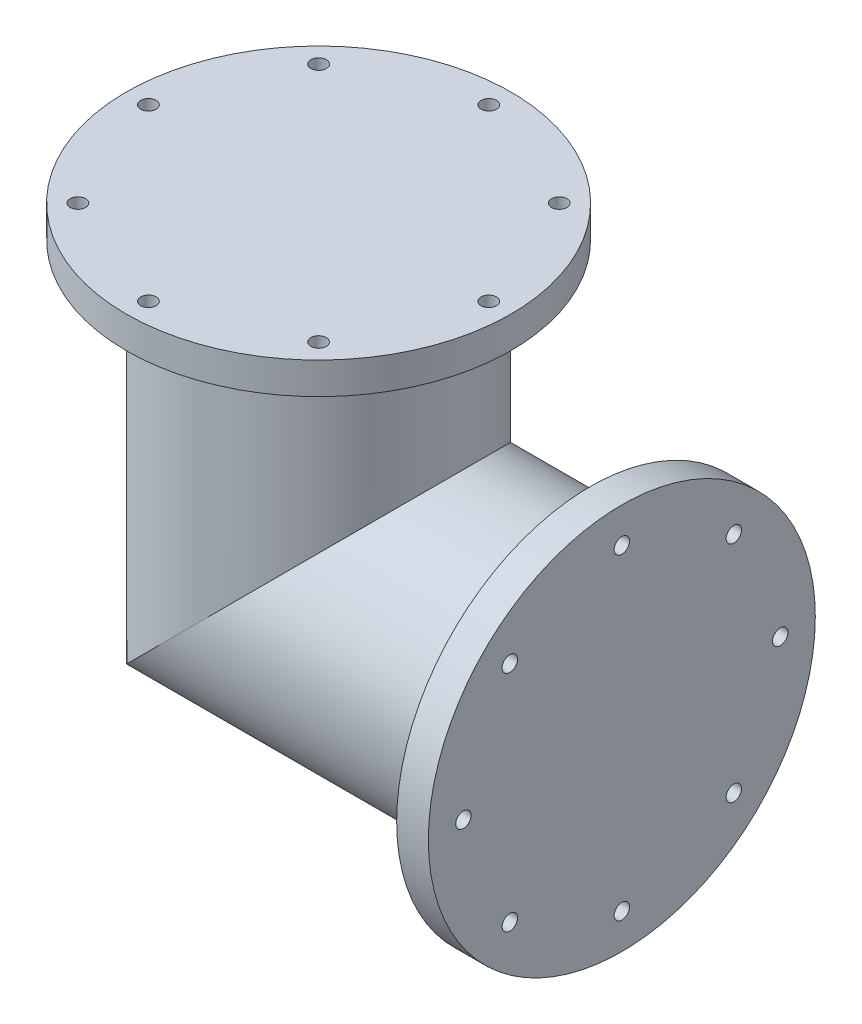
from build123d import *

# Parameters (mm, degrees)
CROQUIS1_R                                     = 42.75
SALIENTE_EXTRUIR1_DEPTH                        = 3.5
SALIENTE_EXTRUIR2_REACH                        = 181
CROQUIS3_R                                     = 30
CROQUIS3_R_2                                   = 25
SALIENTE_EXTRUIR3_REACH                        = 210.151
CROQUIS4_R                                     = 30
CROQUIS4_R_2                                   = 25
REFRENTADO_PARA_TORNILLO_CON_CABEZA_2_COUNT    = 2
REFRENTADO_PARA_TORNILLO_CON_CABEZA_2_PITCH    = 26.787840266
REFRENTADO_PARA_TORNILLO_CON_CABEZA_3_COUNT    = 2
REFRENTADO_PARA_TORNILLO_CON_CABEZA_3_PITCH    = 49.497474683
REFRENTADO_PARA_TORNILLO_CON_CABEZA_4_COUNT    = 2
REFRENTADO_PARA_TORNILLO_CON_CABEZA_4_PITCH    = 64.671567276
REFRENTADO_PARA_TORNILLO_CON_CABEZA_5_COUNT    = 2
REFRENTADO_PARA_TORNILLO_CON_CABEZA_5_PITCH    = 70
REFRENTADO_PARA_TORNILLO_CON_CABEZA_6_COUNT    = 2
REFRENTADO_PARA_TORNILLO_CON_CABEZA_6_PITCH    = 64.671567276
REFRENTADO_PARA_TORNILLO_CON_CABEZA_7_COUNT    = 2
REFRENTADO_PARA_TORNILLO_CON_CABEZA_7_PITCH    = 49.497474683
REFRENTADO_PARA_TORNILLO_CON_CABEZA_8_COUNT    = 2
REFRENTADO_PARA_TORNILLO_CON_CABEZA_8_PITCH    = 26.787840266
CROQUIS8_R                                     = 42.5
SALIENTE_EXTRUIR4_DEPTH                        = 7
REFRENTADO_PARA_TORNILLO_CON_CABEZA_9_AT_COUNT = 2
REFRENTADO_PARA_TORNILLO_CON_CABEZA_9_AT_PITCH = 28.777794114
REFRENTADO_PARA_TORNILLO_CON_CABEZA_10_COUNT   = 2
REFRENTADO_PARA_TORNILLO_CON_CABEZA_10_PITCH   = 53.174429945
REFRENTADO_PARA_TORNILLO_CON_CABEZA_11_COUNT   = 2
REFRENTADO_PARA_TORNILLO_CON_CABEZA_11_PITCH   = 69.475740845
REFRENTADO_PARA_TORNILLO_CON_CABEZA_12_COUNT   = 2
REFRENTADO_PARA_TORNILLO_CON_CABEZA_12_PITCH   = 75.2
REFRENTADO_PARA_TORNILLO_CON_CABEZA_13_COUNT   = 2
REFRENTADO_PARA_TORNILLO_CON_CABEZA_13_PITCH   = 69.475740845
REFRENTADO_PARA_TORNILLO_CON_CABEZA_14_COUNT   = 2
REFRENTADO_PARA_TORNILLO_CON_CABEZA_14_PITCH   = 53.174429945
REFRENTADO_PARA_TORNILLO_CON_CABEZA_15_COUNT   = 2
REFRENTADO_PARA_TORNILLO_CON_CABEZA_15_PITCH   = 28.777794114


with BuildPart() as part:
    # Croquis1 → Saliente-Extruir1 (new, symmetric)
    with BuildSketch(Plane(origin=(0, 0, 0), x_dir=(0, 0, -1), z_dir=(1, 0, 0))):
        Circle(CROQUIS1_R)
    extrude(amount=SALIENTE_EXTRUIR1_DEPTH, both=True)

    # Saliente-Extruir2: up to this plane
    saliente_extruir2_end = Plane(origin=(-63.5, 0, 0), z_dir=(-0.7071067811865489, 0.7071067811865461, 0))
    # Croquis3 → Saliente-Extruir2 (add, up to the surface)
    with BuildSketch(Plane.ZY.offset(3.5), mode=Mode.PRIVATE) as saliente_extruir2_sk1:
        Circle(CROQUIS3_R)
        Circle(CROQUIS3_R_2, mode=Mode.SUBTRACT)
    saliente_extruir2_tool1 = split(extrude(saliente_extruir2_sk1.sketch, amount=SALIENTE_EXTRUIR2_REACH, mode=Mode.PRIVATE), bisect_by=saliente_extruir2_end, keep=Keep.BOTH, mode=Mode.PRIVATE)
    add(saliente_extruir2_tool1.solids().sort_by_distance((-3.5, 0, -29.151472))[0])

    # Croquis7 → Refrentado para tornillo con cabeza tron (revolve, cut)
    with BuildSketch(Plane(origin=(-3.5, 35, 0), x_dir=(0, 0, 1), z_dir=(0, 1, 0))):
        Polygon((0, 0), (0, 7), (1.7, 7), (1.7, 2.4), (3.5, 2.4), (3.5, 0), align=None)
    refrentado_para_tornillo_con_cabeza_tron = revolve(axis=Axis((-9.85, 35, 0), (1, 0, 0)), mode=Mode.SUBTRACT)

    # Refrentado para tornillo con cabeza  2: Refrentado para tornillo con cabeza tron ×2
    with Locations(*[Vector(0, -0.3826834323650482, 0.9238795325113041) * (i * REFRENTADO_PARA_TORNILLO_CON_CABEZA_2_PITCH) for i in range(1, REFRENTADO_PARA_TORNILLO_CON_CABEZA_2_COUNT)]):
        add(refrentado_para_tornillo_con_cabeza_tron, mode=Mode.SUBTRACT)

    # Refrentado para tornillo con cabeza  3: Refrentado para tornillo con cabeza tron ×2
    with Locations(*[Vector(0, -0.7071067811865158, 0.7071067811865792) * (i * REFRENTADO_PARA_TORNILLO_CON_CABEZA_3_PITCH) for i in range(1, REFRENTADO_PARA_TORNILLO_CON_CABEZA_3_COUNT)]):
        add(refrentado_para_tornillo_con_cabeza_tron, mode=Mode.SUBTRACT)

    # Refrentado para tornillo con cabeza  4: Refrentado para tornillo con cabeza tron ×2
    with Locations(*[Vector(0, -0.9238795325112696, 0.3826834323651312) * (i * REFRENTADO_PARA_TORNILLO_CON_CABEZA_4_PITCH) for i in range(1, REFRENTADO_PARA_TORNILLO_CON_CABEZA_4_COUNT)]):
        add(refrentado_para_tornillo_con_cabeza_tron, mode=Mode.SUBTRACT)

    # Refrentado para tornillo con cabeza  5: Refrentado para tornillo con cabeza tron ×2
    with Locations(*[(0, -i * REFRENTADO_PARA_TORNILLO_CON_CABEZA_5_PITCH, 0) for i in range(1, REFRENTADO_PARA_TORNILLO_CON_CABEZA_5_COUNT)]):
        add(refrentado_para_tornillo_con_cabeza_tron, mode=Mode.SUBTRACT)

    # Refrentado para tornillo con cabeza  6: Refrentado para tornillo con cabeza tron ×2
    with Locations(*[Vector(0, -0.923879532511304, -0.38268343236504837) * (i * REFRENTADO_PARA_TORNILLO_CON_CABEZA_6_PITCH) for i in range(1, REFRENTADO_PARA_TORNILLO_CON_CABEZA_6_COUNT)]):
        add(refrentado_para_tornillo_con_cabeza_tron, mode=Mode.SUBTRACT)

    # Refrentado para tornillo con cabeza  7: Refrentado para tornillo con cabeza tron ×2
    with Locations(*[Vector(0, -0.7071067811865792, -0.7071067811865158) * (i * REFRENTADO_PARA_TORNILLO_CON_CABEZA_7_PITCH) for i in range(1, REFRENTADO_PARA_TORNILLO_CON_CABEZA_7_COUNT)]):
        add(refrentado_para_tornillo_con_cabeza_tron, mode=Mode.SUBTRACT)

    # Refrentado para tornillo con cabeza  8: Refrentado para tornillo con cabeza tron ×2
    with Locations(*[Vector(0, -0.3826834323651309, -0.9238795325112698) * (i * REFRENTADO_PARA_TORNILLO_CON_CABEZA_8_PITCH) for i in range(1, REFRENTADO_PARA_TORNILLO_CON_CABEZA_8_COUNT)]):
        add(refrentado_para_tornillo_con_cabeza_tron, mode=Mode.SUBTRACT)


with BuildPart() as body_2:
    # Saliente-Extruir3: up to this plane
    saliente_extruir3_end = Plane(origin=(-63.5, 0, 0), z_dir=(-0.7071067811865489, 0.7071067811865461, 0))
    # Croquis4 → Saliente-Extruir3 (new, up to the surface)
    with BuildSketch(Plane(origin=(0, 60, 0), x_dir=(1, 0, 0), z_dir=(0, 1, 0)), mode=Mode.PRIVATE) as saliente_extruir3_sk1:
        with Locations((-63.5, 0)):
            Circle(CROQUIS4_R)
        with Locations((-63.5, 0)):
            Circle(CROQUIS4_R_2, mode=Mode.SUBTRACT)
    saliente_extruir3_tool1 = split(extrude(saliente_extruir3_sk1.sketch, amount=-SALIENTE_EXTRUIR3_REACH, mode=Mode.PRIVATE), bisect_by=saliente_extruir3_end, keep=Keep.BOTH, mode=Mode.PRIVATE)
    add(saliente_extruir3_tool1.solids().sort_by_distance((-92.651472, 60, 0))[0])

    # Croquis8 → Saliente-Extruir4 (add)
    with BuildSketch(Plane(origin=(0, 60, 0), x_dir=(1, 0, 0), z_dir=(0, 1, 0))):
        with Locations((-63.5, 0)):
            Circle(CROQUIS8_R)
    extrude(amount=SALIENTE_EXTRUIR4_DEPTH)

    # Croquis10 → Refrentado para tornillo con cabeza  9 (revolve, cut)
    with BuildSketch(Plane(origin=(-63.5, 60, 37.6), x_dir=(0, 0, -1), z_dir=(1, 0, 0))):
        Polygon((0, 0), (0, 7.001), (1.7, 7.001), (1.7, 2.4), (3.5, 2.4), (3.5, 0), align=None)
    refrentado_para_tornillo_con_cabeza_9 = revolve(axis=Axis((-63.5, 53.65, 37.6), (0, 1, 0)), mode=Mode.SUBTRACT)

    # Refrentado para tornillo con cabeza 9 at: Refrentado para tornillo con cabeza  9 ×2
    with Locations(*[Vector(0.923879532511287, 0, -0.38268343236508934) * (i * REFRENTADO_PARA_TORNILLO_CON_CABEZA_9_AT_PITCH) for i in range(1, REFRENTADO_PARA_TORNILLO_CON_CABEZA_9_AT_COUNT)]):
        add(refrentado_para_tornillo_con_cabeza_9, mode=Mode.SUBTRACT)

    # Refrentado para tornillo con cabeza  10: Refrentado para tornillo con cabeza  9 ×2
    with Locations(*[Vector(0.7071067811865479, 0, -0.7071067811865471) * (i * REFRENTADO_PARA_TORNILLO_CON_CABEZA_10_PITCH) for i in range(1, REFRENTADO_PARA_TORNILLO_CON_CABEZA_10_COUNT)]):
        add(refrentado_para_tornillo_con_cabeza_9, mode=Mode.SUBTRACT)

    # Refrentado para tornillo con cabeza  11: Refrentado para tornillo con cabeza  9 ×2
    with Locations(*[Vector(0.3826834323650902, 0, -0.9238795325112866) * (i * REFRENTADO_PARA_TORNILLO_CON_CABEZA_11_PITCH) for i in range(1, REFRENTADO_PARA_TORNILLO_CON_CABEZA_11_COUNT)]):
        add(refrentado_para_tornillo_con_cabeza_9, mode=Mode.SUBTRACT)

    # Refrentado para tornillo con cabeza  12: Refrentado para tornillo con cabeza  9 ×2
    with Locations(*[(0, 0, -i * REFRENTADO_PARA_TORNILLO_CON_CABEZA_12_PITCH) for i in range(1, REFRENTADO_PARA_TORNILLO_CON_CABEZA_12_COUNT)]):
        add(refrentado_para_tornillo_con_cabeza_9, mode=Mode.SUBTRACT)

    # Refrentado para tornillo con cabeza  13: Refrentado para tornillo con cabeza  9 ×2
    with Locations(*[Vector(-0.38268343236508945, 0, -0.923879532511287) * (i * REFRENTADO_PARA_TORNILLO_CON_CABEZA_13_PITCH) for i in range(1, REFRENTADO_PARA_TORNILLO_CON_CABEZA_13_COUNT)]):
        add(refrentado_para_tornillo_con_cabeza_9, mode=Mode.SUBTRACT)

    # Refrentado para tornillo con cabeza  14: Refrentado para tornillo con cabeza  9 ×2
    with Locations(*[Vector(-0.7071067811865472, 0, -0.7071067811865478) * (i * REFRENTADO_PARA_TORNILLO_CON_CABEZA_14_PITCH) for i in range(1, REFRENTADO_PARA_TORNILLO_CON_CABEZA_14_COUNT)]):
        add(refrentado_para_tornillo_con_cabeza_9, mode=Mode.SUBTRACT)

    # Refrentado para tornillo con cabeza  15: Refrentado para tornillo con cabeza  9 ×2
    with Locations(*[Vector(-0.9238795325112866, 0, -0.3826834323650901) * (i * REFRENTADO_PARA_TORNILLO_CON_CABEZA_15_PITCH) for i in range(1, REFRENTADO_PARA_TORNILLO_CON_CABEZA_15_COUNT)]):
        add(refrentado_para_tornillo_con_cabeza_9, mode=Mode.SUBTRACT)


solid = Compound([part.part, body_2.part])
